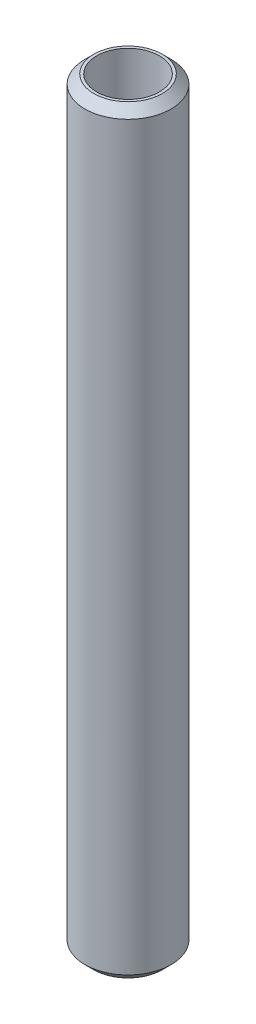
from build123d import *

# Parameters (mm, degrees)
SKETCH1_R           = 22.5
BOSS_EXTRUDE1_DEPTH = 396.279738217
SKETCH2_R           = 16.380234795
CUT_EXTRUDE1_DEPTH  = 398.555192296
CHAMFER1_SIZE       = 4.660592042


with BuildPart() as part:
    # Sketch1 → Boss-Extrude1 (new body)
    with BuildSketch(Plane(origin=(0, 0, 0), x_dir=(1, 0, 0), z_dir=(0, 1, 0))):
        Circle(SKETCH1_R)
    extrude(amount=BOSS_EXTRUDE1_DEPTH)

    # Sketch2 → Cut-Extrude1 (cut, through all)
    with BuildSketch(Plane(origin=(0, 0, 0), x_dir=(1, 0, 0), z_dir=(0, 1, 0))):
        Circle(SKETCH2_R)
    extrude(amount=CUT_EXTRUDE1_DEPTH, mode=Mode.SUBTRACT)

    # Chamfer1
    chamfer1_edges = [part.edges().sort_by_distance(p)[0] for p in [
        (-22.5, 396.279738217, 0),
        (-22.5, 0, 0),
    ]]
    chamfer(chamfer1_edges, length=CHAMFER1_SIZE)


solid = part.part
